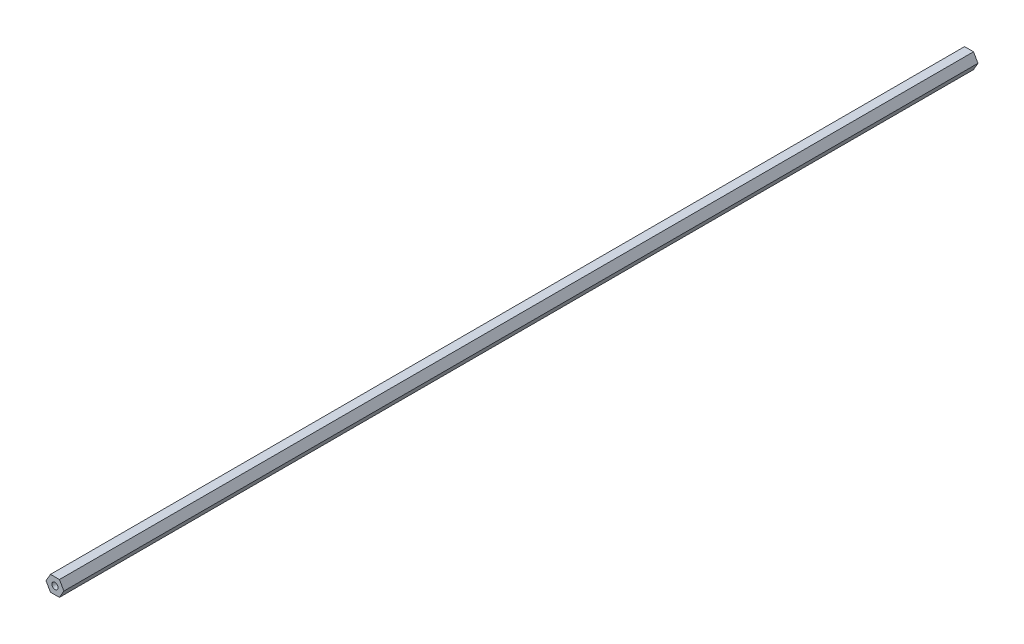
from build123d import *

# Parameters (mm, degrees)
SKETCH1_R           = 2.5527
BOSS_EXTRUDE1_DEPTH = 749.3


with BuildPart() as part:
    # Sketch1 → Boss-Extrude1 (new body)
    with BuildSketch(Plane.XY):
        Polygon((3.666174209, -6.35), (7.332348419, 0), (3.666174209, 6.35), (-3.666174209, 6.35), (-7.332348419, 0), (-3.666174209, -6.35), align=None)
        Circle(SKETCH1_R, mode=Mode.SUBTRACT)
    extrude(amount=BOSS_EXTRUDE1_DEPTH)


solid = part.part
